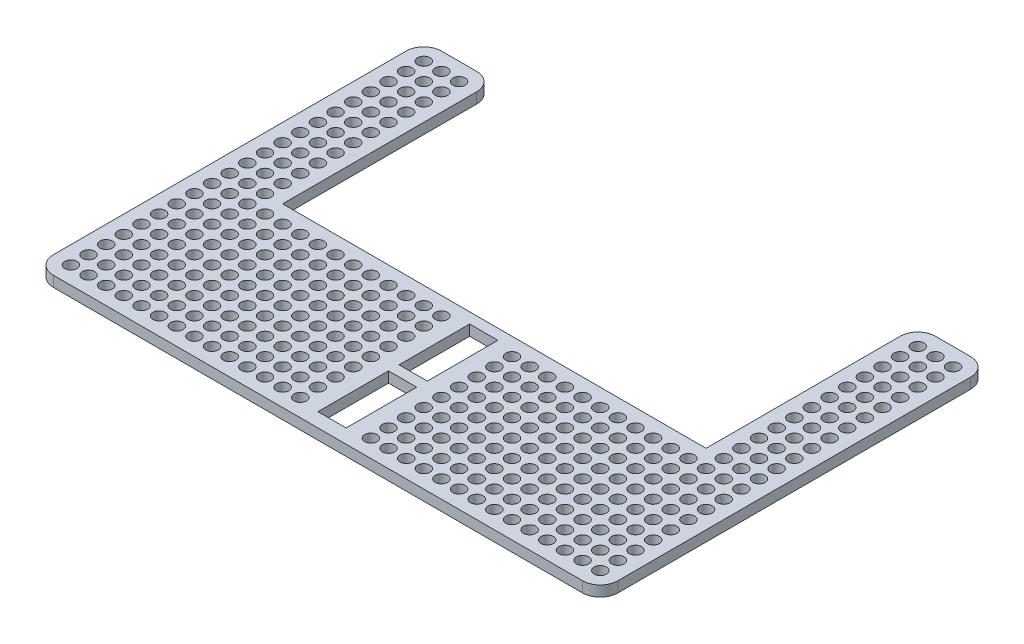
from build123d import *

# Parameters (mm, degrees)
SKETCH1_R           = 1.75
BOSS_EXTRUDE1_DEPTH = 3


with BuildPart() as part:
    # Sketch1 → Boss-Extrude1 (new body)
    with BuildSketch(Plane(origin=(0, 0, 0), x_dir=(1, 0, 0), z_dir=(0, 1, 0))):
        with BuildLine():
            Line((0, -20), (-60, -20))
            Line((-60, -20), (-60, 35))
            ThreePointArc((-60, 35), (-61.464466094, 38.535533906), (-65, 40))
            Line((-65, 40), (-75, 40))
            ThreePointArc((-75, 40), (-78.535533906, 38.535533906), (-80, 35))
            Line((-80, 35), (-80, -65))
            ThreePointArc((-80, -65), (-78.535533906, -68.535533906), (-75, -70))
            Line((-75, -70), (0, -70))
            Line((0, -70), (0, -66))
            Line((0, -66), (-4, -66))
            Line((-4, -66), (-4, -46))
            Line((-4, -46), (0, -46))
            Line((0, -46), (0, -43))
            Line((0, -43), (-4, -43))
            Line((-4, -43), (-4, -23))
            Line((-4, -23), (0, -23))
            Line((0, -23), (0, -20))
        make_face()
        with Locations((-65, 0)):
            Circle(SKETCH1_R, mode=Mode.SUBTRACT)
        with Locations((-70, 0)):
            Circle(SKETCH1_R, mode=Mode.SUBTRACT)
        with Locations((-75, 0)):
            Circle(SKETCH1_R, mode=Mode.SUBTRACT)
        with Locations((-75, 5)):
            Circle(SKETCH1_R, mode=Mode.SUBTRACT)
        with Locations((-70, 5)):
            Circle(SKETCH1_R, mode=Mode.SUBTRACT)
        with Locations((-65, 5)):
            Circle(SKETCH1_R, mode=Mode.SUBTRACT)
        with Locations((-75, 10)):
            Circle(SKETCH1_R, mode=Mode.SUBTRACT)
        with Locations((-70, 10)):
            Circle(SKETCH1_R, mode=Mode.SUBTRACT)
        with Locations((-65, 10)):
            Circle(SKETCH1_R, mode=Mode.SUBTRACT)
        with Locations((-75, 15)):
            Circle(SKETCH1_R, mode=Mode.SUBTRACT)
        with Locations((-70, 15)):
            Circle(SKETCH1_R, mode=Mode.SUBTRACT)
        with Locations((-65, 15)):
            Circle(SKETCH1_R, mode=Mode.SUBTRACT)
        with Locations((-75, 20)):
            Circle(SKETCH1_R, mode=Mode.SUBTRACT)
        with Locations((-70, 20)):
            Circle(SKETCH1_R, mode=Mode.SUBTRACT)
        with Locations((-65, 20)):
            Circle(SKETCH1_R, mode=Mode.SUBTRACT)
        with Locations((-75, 25)):
            Circle(SKETCH1_R, mode=Mode.SUBTRACT)
        with Locations((-70, 25)):
            Circle(SKETCH1_R, mode=Mode.SUBTRACT)
        with Locations((-65, 25)):
            Circle(SKETCH1_R, mode=Mode.SUBTRACT)
        with Locations((-75, 30)):
            Circle(SKETCH1_R, mode=Mode.SUBTRACT)
        with Locations((-70, 30)):
            Circle(SKETCH1_R, mode=Mode.SUBTRACT)
        with Locations((-65, 30)):
            Circle(SKETCH1_R, mode=Mode.SUBTRACT)
        with Locations((-75, 35)):
            Circle(SKETCH1_R, mode=Mode.SUBTRACT)
        with Locations((-70, 35)):
            Circle(SKETCH1_R, mode=Mode.SUBTRACT)
        with Locations((-65, 35)):
            Circle(SKETCH1_R, mode=Mode.SUBTRACT)
        with Locations((-75, -5)):
            Circle(SKETCH1_R, mode=Mode.SUBTRACT)
        with Locations((-70, -5)):
            Circle(SKETCH1_R, mode=Mode.SUBTRACT)
        with Locations((-65, -5)):
            Circle(SKETCH1_R, mode=Mode.SUBTRACT)
        with Locations((-75, -10)):
            Circle(SKETCH1_R, mode=Mode.SUBTRACT)
        with Locations((-70, -10)):
            Circle(SKETCH1_R, mode=Mode.SUBTRACT)
        with Locations((-65, -10)):
            Circle(SKETCH1_R, mode=Mode.SUBTRACT)
        with Locations((-75, -15)):
            Circle(SKETCH1_R, mode=Mode.SUBTRACT)
        with Locations((-70, -15)):
            Circle(SKETCH1_R, mode=Mode.SUBTRACT)
        with Locations((-65, -15)):
            Circle(SKETCH1_R, mode=Mode.SUBTRACT)
        with Locations((-75, -20)):
            Circle(SKETCH1_R, mode=Mode.SUBTRACT)
        with Locations((-70, -20)):
            Circle(SKETCH1_R, mode=Mode.SUBTRACT)
        with Locations((-65, -20)):
            Circle(SKETCH1_R, mode=Mode.SUBTRACT)
        with Locations((-75, -25)):
            Circle(SKETCH1_R, mode=Mode.SUBTRACT)
        with Locations((-70, -25)):
            Circle(SKETCH1_R, mode=Mode.SUBTRACT)
        with Locations((-65, -25)):
            Circle(SKETCH1_R, mode=Mode.SUBTRACT)
        with Locations((-75, -30)):
            Circle(SKETCH1_R, mode=Mode.SUBTRACT)
        with Locations((-70, -30)):
            Circle(SKETCH1_R, mode=Mode.SUBTRACT)
        with Locations((-65, -30)):
            Circle(SKETCH1_R, mode=Mode.SUBTRACT)
        with Locations((-75, -35)):
            Circle(SKETCH1_R, mode=Mode.SUBTRACT)
        with Locations((-70, -35)):
            Circle(SKETCH1_R, mode=Mode.SUBTRACT)
        with Locations((-65, -35)):
            Circle(SKETCH1_R, mode=Mode.SUBTRACT)
        with Locations((-75, -40)):
            Circle(SKETCH1_R, mode=Mode.SUBTRACT)
        with Locations((-70, -40)):
            Circle(SKETCH1_R, mode=Mode.SUBTRACT)
        with Locations((-65, -40)):
            Circle(SKETCH1_R, mode=Mode.SUBTRACT)
        with Locations((-75, -45)):
            Circle(SKETCH1_R, mode=Mode.SUBTRACT)
        with Locations((-70, -45)):
            Circle(SKETCH1_R, mode=Mode.SUBTRACT)
        with Locations((-65, -45)):
            Circle(SKETCH1_R, mode=Mode.SUBTRACT)
        with Locations((-75, -50)):
            Circle(SKETCH1_R, mode=Mode.SUBTRACT)
        with Locations((-70, -50)):
            Circle(SKETCH1_R, mode=Mode.SUBTRACT)
        with Locations((-65, -50)):
            Circle(SKETCH1_R, mode=Mode.SUBTRACT)
        with Locations((-75, -55)):
            Circle(SKETCH1_R, mode=Mode.SUBTRACT)
        with Locations((-70, -55)):
            Circle(SKETCH1_R, mode=Mode.SUBTRACT)
        with Locations((-65, -55)):
            Circle(SKETCH1_R, mode=Mode.SUBTRACT)
        with Locations((-75, -60)):
            Circle(SKETCH1_R, mode=Mode.SUBTRACT)
        with Locations((-70, -60)):
            Circle(SKETCH1_R, mode=Mode.SUBTRACT)
        with Locations((-65, -60)):
            Circle(SKETCH1_R, mode=Mode.SUBTRACT)
        with Locations((-75, -65)):
            Circle(SKETCH1_R, mode=Mode.SUBTRACT)
        with Locations((-70, -65)):
            Circle(SKETCH1_R, mode=Mode.SUBTRACT)
        with Locations((-65, -65)):
            Circle(SKETCH1_R, mode=Mode.SUBTRACT)
        with Locations((-60, -65)):
            Circle(SKETCH1_R, mode=Mode.SUBTRACT)
        with Locations((-60, -60)):
            Circle(SKETCH1_R, mode=Mode.SUBTRACT)
        with Locations((-60, -55)):
            Circle(SKETCH1_R, mode=Mode.SUBTRACT)
        with Locations((-60, -50)):
            Circle(SKETCH1_R, mode=Mode.SUBTRACT)
        with Locations((-60, -45)):
            Circle(SKETCH1_R, mode=Mode.SUBTRACT)
        with Locations((-60, -40)):
            Circle(SKETCH1_R, mode=Mode.SUBTRACT)
        with Locations((-60, -35)):
            Circle(SKETCH1_R, mode=Mode.SUBTRACT)
        with Locations((-60, -30)):
            Circle(SKETCH1_R, mode=Mode.SUBTRACT)
        with Locations((-60, -25)):
            Circle(SKETCH1_R, mode=Mode.SUBTRACT)
        with Locations((-55, -65)):
            Circle(SKETCH1_R, mode=Mode.SUBTRACT)
        with Locations((-55, -60)):
            Circle(SKETCH1_R, mode=Mode.SUBTRACT)
        with Locations((-55, -55)):
            Circle(SKETCH1_R, mode=Mode.SUBTRACT)
        with Locations((-55, -50)):
            Circle(SKETCH1_R, mode=Mode.SUBTRACT)
        with Locations((-55, -45)):
            Circle(SKETCH1_R, mode=Mode.SUBTRACT)
        with Locations((-55, -40)):
            Circle(SKETCH1_R, mode=Mode.SUBTRACT)
        with Locations((-55, -35)):
            Circle(SKETCH1_R, mode=Mode.SUBTRACT)
        with Locations((-55, -30)):
            Circle(SKETCH1_R, mode=Mode.SUBTRACT)
        with Locations((-55, -25)):
            Circle(SKETCH1_R, mode=Mode.SUBTRACT)
        with Locations((-50, -65)):
            Circle(SKETCH1_R, mode=Mode.SUBTRACT)
        with Locations((-50, -60)):
            Circle(SKETCH1_R, mode=Mode.SUBTRACT)
        with Locations((-50, -55)):
            Circle(SKETCH1_R, mode=Mode.SUBTRACT)
        with Locations((-50, -50)):
            Circle(SKETCH1_R, mode=Mode.SUBTRACT)
        with Locations((-50, -45)):
            Circle(SKETCH1_R, mode=Mode.SUBTRACT)
        with Locations((-50, -40)):
            Circle(SKETCH1_R, mode=Mode.SUBTRACT)
        with Locations((-50, -35)):
            Circle(SKETCH1_R, mode=Mode.SUBTRACT)
        with Locations((-50, -30)):
            Circle(SKETCH1_R, mode=Mode.SUBTRACT)
        with Locations((-50, -25)):
            Circle(SKETCH1_R, mode=Mode.SUBTRACT)
        with Locations((-45, -65)):
            Circle(SKETCH1_R, mode=Mode.SUBTRACT)
        with Locations((-45, -60)):
            Circle(SKETCH1_R, mode=Mode.SUBTRACT)
        with Locations((-45, -55)):
            Circle(SKETCH1_R, mode=Mode.SUBTRACT)
        with Locations((-45, -50)):
            Circle(SKETCH1_R, mode=Mode.SUBTRACT)
        with Locations((-45, -45)):
            Circle(SKETCH1_R, mode=Mode.SUBTRACT)
        with Locations((-45, -40)):
            Circle(SKETCH1_R, mode=Mode.SUBTRACT)
        with Locations((-45, -35)):
            Circle(SKETCH1_R, mode=Mode.SUBTRACT)
        with Locations((-45, -30)):
            Circle(SKETCH1_R, mode=Mode.SUBTRACT)
        with Locations((-45, -25)):
            Circle(SKETCH1_R, mode=Mode.SUBTRACT)
        with Locations((-40, -65)):
            Circle(SKETCH1_R, mode=Mode.SUBTRACT)
        with Locations((-40, -60)):
            Circle(SKETCH1_R, mode=Mode.SUBTRACT)
        with Locations((-40, -55)):
            Circle(SKETCH1_R, mode=Mode.SUBTRACT)
        with Locations((-40, -50)):
            Circle(SKETCH1_R, mode=Mode.SUBTRACT)
        with Locations((-40, -45)):
            Circle(SKETCH1_R, mode=Mode.SUBTRACT)
        with Locations((-40, -40)):
            Circle(SKETCH1_R, mode=Mode.SUBTRACT)
        with Locations((-40, -35)):
            Circle(SKETCH1_R, mode=Mode.SUBTRACT)
        with Locations((-40, -30)):
            Circle(SKETCH1_R, mode=Mode.SUBTRACT)
        with Locations((-40, -25)):
            Circle(SKETCH1_R, mode=Mode.SUBTRACT)
        with Locations((-35, -65)):
            Circle(SKETCH1_R, mode=Mode.SUBTRACT)
        with Locations((-35, -60)):
            Circle(SKETCH1_R, mode=Mode.SUBTRACT)
        with Locations((-35, -55)):
            Circle(SKETCH1_R, mode=Mode.SUBTRACT)
        with Locations((-35, -50)):
            Circle(SKETCH1_R, mode=Mode.SUBTRACT)
        with Locations((-35, -45)):
            Circle(SKETCH1_R, mode=Mode.SUBTRACT)
        with Locations((-35, -40)):
            Circle(SKETCH1_R, mode=Mode.SUBTRACT)
        with Locations((-35, -35)):
            Circle(SKETCH1_R, mode=Mode.SUBTRACT)
        with Locations((-35, -30)):
            Circle(SKETCH1_R, mode=Mode.SUBTRACT)
        with Locations((-35, -25)):
            Circle(SKETCH1_R, mode=Mode.SUBTRACT)
        with Locations((-30, -65)):
            Circle(SKETCH1_R, mode=Mode.SUBTRACT)
        with Locations((-30, -60)):
            Circle(SKETCH1_R, mode=Mode.SUBTRACT)
        with Locations((-30, -55)):
            Circle(SKETCH1_R, mode=Mode.SUBTRACT)
        with Locations((-30, -50)):
            Circle(SKETCH1_R, mode=Mode.SUBTRACT)
        with Locations((-30, -45)):
            Circle(SKETCH1_R, mode=Mode.SUBTRACT)
        with Locations((-30, -40)):
            Circle(SKETCH1_R, mode=Mode.SUBTRACT)
        with Locations((-30, -35)):
            Circle(SKETCH1_R, mode=Mode.SUBTRACT)
        with Locations((-30, -30)):
            Circle(SKETCH1_R, mode=Mode.SUBTRACT)
        with Locations((-30, -25)):
            Circle(SKETCH1_R, mode=Mode.SUBTRACT)
        with Locations((-25, -65)):
            Circle(SKETCH1_R, mode=Mode.SUBTRACT)
        with Locations((-25, -60)):
            Circle(SKETCH1_R, mode=Mode.SUBTRACT)
        with Locations((-25, -55)):
            Circle(SKETCH1_R, mode=Mode.SUBTRACT)
        with Locations((-25, -50)):
            Circle(SKETCH1_R, mode=Mode.SUBTRACT)
        with Locations((-25, -45)):
            Circle(SKETCH1_R, mode=Mode.SUBTRACT)
        with Locations((-25, -40)):
            Circle(SKETCH1_R, mode=Mode.SUBTRACT)
        with Locations((-25, -35)):
            Circle(SKETCH1_R, mode=Mode.SUBTRACT)
        with Locations((-25, -30)):
            Circle(SKETCH1_R, mode=Mode.SUBTRACT)
        with Locations((-25, -25)):
            Circle(SKETCH1_R, mode=Mode.SUBTRACT)
        with Locations((-20, -65)):
            Circle(SKETCH1_R, mode=Mode.SUBTRACT)
        with Locations((-20, -60)):
            Circle(SKETCH1_R, mode=Mode.SUBTRACT)
        with Locations((-20, -55)):
            Circle(SKETCH1_R, mode=Mode.SUBTRACT)
        with Locations((-20, -50)):
            Circle(SKETCH1_R, mode=Mode.SUBTRACT)
        with Locations((-20, -45)):
            Circle(SKETCH1_R, mode=Mode.SUBTRACT)
        with Locations((-20, -40)):
            Circle(SKETCH1_R, mode=Mode.SUBTRACT)
        with Locations((-20, -35)):
            Circle(SKETCH1_R, mode=Mode.SUBTRACT)
        with Locations((-20, -30)):
            Circle(SKETCH1_R, mode=Mode.SUBTRACT)
        with Locations((-20, -25)):
            Circle(SKETCH1_R, mode=Mode.SUBTRACT)
        with Locations((-15, -65)):
            Circle(SKETCH1_R, mode=Mode.SUBTRACT)
        with Locations((-15, -60)):
            Circle(SKETCH1_R, mode=Mode.SUBTRACT)
        with Locations((-15, -55)):
            Circle(SKETCH1_R, mode=Mode.SUBTRACT)
        with Locations((-15, -50)):
            Circle(SKETCH1_R, mode=Mode.SUBTRACT)
        with Locations((-15, -45)):
            Circle(SKETCH1_R, mode=Mode.SUBTRACT)
        with Locations((-15, -40)):
            Circle(SKETCH1_R, mode=Mode.SUBTRACT)
        with Locations((-15, -35)):
            Circle(SKETCH1_R, mode=Mode.SUBTRACT)
        with Locations((-15, -30)):
            Circle(SKETCH1_R, mode=Mode.SUBTRACT)
        with Locations((-15, -25)):
            Circle(SKETCH1_R, mode=Mode.SUBTRACT)
        with Locations((-10, -65)):
            Circle(SKETCH1_R, mode=Mode.SUBTRACT)
        with Locations((-10, -60)):
            Circle(SKETCH1_R, mode=Mode.SUBTRACT)
        with Locations((-10, -55)):
            Circle(SKETCH1_R, mode=Mode.SUBTRACT)
        with Locations((-10, -50)):
            Circle(SKETCH1_R, mode=Mode.SUBTRACT)
        with Locations((-10, -45)):
            Circle(SKETCH1_R, mode=Mode.SUBTRACT)
        with Locations((-10, -40)):
            Circle(SKETCH1_R, mode=Mode.SUBTRACT)
        with Locations((-10, -35)):
            Circle(SKETCH1_R, mode=Mode.SUBTRACT)
        with Locations((-10, -30)):
            Circle(SKETCH1_R, mode=Mode.SUBTRACT)
        with Locations((-10, -25)):
            Circle(SKETCH1_R, mode=Mode.SUBTRACT)
    boss_extrude1 = extrude(amount=BOSS_EXTRUDE1_DEPTH)

    # Mirror1: Boss-Extrude1 across plane
    add(boss_extrude1.mirror(Plane(origin=(0, 0, 0), x_dir=(0, 0, 1), z_dir=(1, 0, 0))))


solid = part.part
